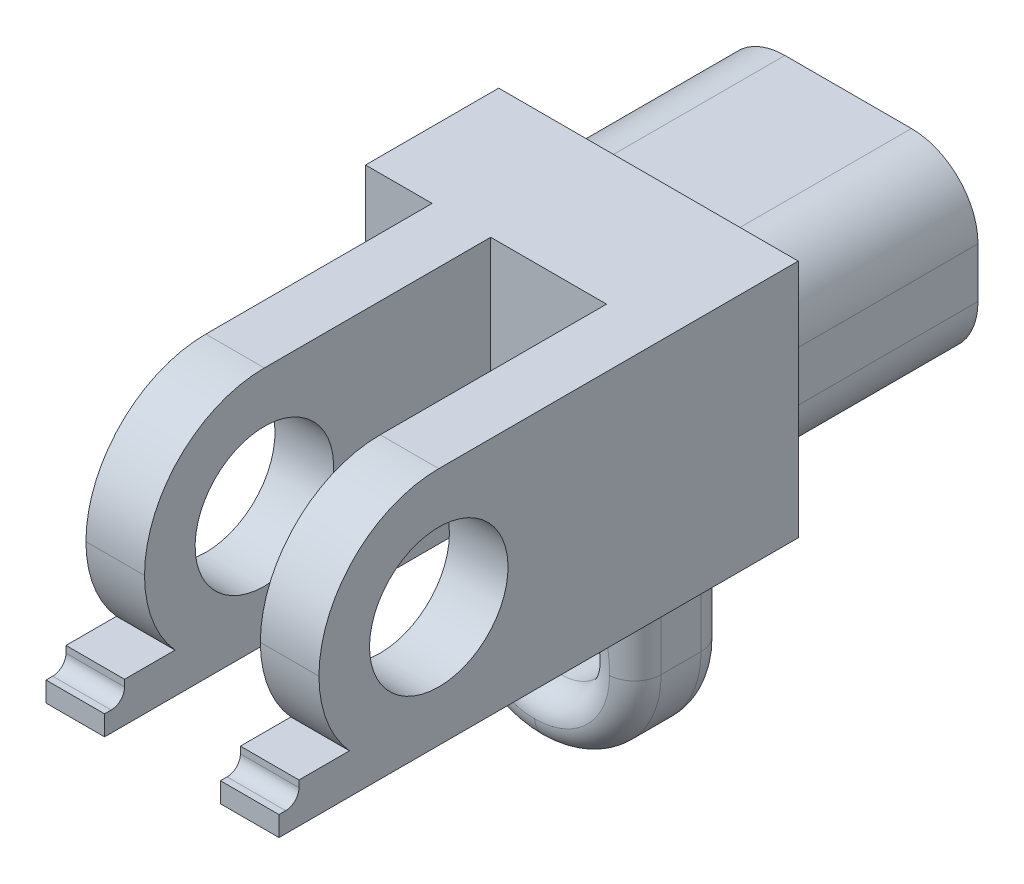
from build123d import *

# Parameters (mm, degrees)
SKETCH2_W           = 24.765
SKETCH2_H           = 17.4625
BOSS_EXTRUDE1_DEPTH = 19.05
SKETCH3_W           = 28.575
SKETCH3_H           = 22.86
BOSS_EXTRUDE2_DEPTH = 45.72
SKETCH4_W           = 6.35
SKETCH4_H           = 33.02
SKETCH4_W_2         = 11.049
CUT_EXTRUDE1_DEPTH  = 54.075706837
SKETCH5_W           = 19.05
SKETCH5_H           = 8.89
BOSS_EXTRUDE3_DEPTH = 19.05
FILLET1_R           = 9.525
SKETCH6_R           = 4.7625
CUT_EXTRUDE2_DEPTH  = 56.202869568
FILLET5_R           = 11.43
SKETCH7_R           = 6.604
CUT_EXTRUDE3_DEPTH  = 60.273091914
FILLET2_R           = 2.54
FILLET3_R           = 6.35
BOSS_EXTRUDE5_DEPTH = 5.588
BOSS_EXTRUDE6_DEPTH = 5.588
SKETCH17_W          = 1.905
SKETCH17_H          = 1.905
CUT_EXTRUDE9_DEPTH  = 63.259151384
FILLET6_R           = 1.27


# Some blends are built 0.0001 mm under size
with BuildPart() as part:
    # Sketch2 → Boss-Extrude1 (new body)
    with BuildSketch(Plane.XY):
        Rectangle(SKETCH2_W, SKETCH2_H)
    extrude(amount=-BOSS_EXTRUDE1_DEPTH)

    # Sketch3 → Boss-Extrude2 (add)
    with BuildSketch(Plane.XY):
        Rectangle(SKETCH3_W, SKETCH3_H)
    extrude(amount=BOSS_EXTRUDE2_DEPTH)

    # Sketch4 → Cut-Extrude1 (cut, through all)
    with BuildSketch(Plane(origin=(0, -11.43, 0), x_dir=(-1, 0, 0), z_dir=(0, -1, 0))):
        with Locations((11.1125, -29.21)):
            Rectangle(SKETCH4_W, SKETCH4_H)
        with Locations((-3.175, -29.21)):
            Rectangle(SKETCH4_W_2, SKETCH4_H)
    extrude(amount=-CUT_EXTRUDE1_DEPTH, mode=Mode.SUBTRACT)

    # Sketch5 → Boss-Extrude3 (add)
    with BuildSketch(Plane.XZ.offset(11.43)):
        with Locations((0, 6.4135)):
            Rectangle(SKETCH5_W, SKETCH5_H)
    extrude(amount=BOSS_EXTRUDE3_DEPTH)

    # Fillet1
    fillet1_edges = [part.edges().sort_by_distance(p)[0] for p in [
        (9.525, -30.48, 6.4135),
        (-9.525, -30.48, 6.4135),
    ]]
    fillet(fillet1_edges, radius=FILLET1_R - 0.0001)  # a hair under: the kernel refuses the full size

    # Sketch6 → Cut-Extrude2 (cut, through all)
    with BuildSketch(Plane(origin=(0, 0, 1.9685), x_dir=(-1, 0, 0), z_dir=(0, 0, -1))):
        with Locations((0, -20.955)):
            Circle(SKETCH6_R)
    extrude(amount=-CUT_EXTRUDE2_DEPTH, mode=Mode.SUBTRACT)

    # Fillet5
    fillet5_edges = [part.edges().sort_by_distance(p)[0] for p in [
        (-5.1435, -11.43, 45.72),
        (-5.1435, 11.43, 45.72),
        (11.4935, 11.43, 45.72),
        (11.4935, -11.43, 45.72),
    ]]
    fillet(fillet5_edges, radius=FILLET5_R - 0.0001)  # a hair under: the kernel refuses the full size

    # Sketch7 → Cut-Extrude3 (cut, through all)
    with BuildSketch(Plane.ZY.offset(7.9375)):
        with Locations(Location((34.29, 0, 0), (0, 0, 270))):
            Circle(SKETCH7_R)
    extrude(amount=-CUT_EXTRUDE3_DEPTH, mode=Mode.SUBTRACT)

    # Fillet2
    # the kernel refuses this fillet: 2.54 mm, written as the material it takes off along each edge
    with BuildSketch(Plane(origin=(-9.525, -11.43, 10.8585), x_dir=(0, 0, -1), z_dir=(0, -1, 0))) as fillet2_piece_1:
        with BuildLine():
            CenterArc((FILLET2_R, FILLET2_R), FILLET2_R, 180, 90)
            Line((0, FILLET2_R), (0, 0))
            Line((0, 0), (FILLET2_R, 0))
        make_face()
    extrude(amount=9.5251, mode=Mode.SUBTRACT)
    with BuildSketch(Plane(origin=(9.525, -11.43, 10.8585), x_dir=(0, 0, -1), z_dir=(0, -1, 0)), Plane(origin=(9.525, -11.43, 1.9685), x_dir=(-1, 0, 0), z_dir=(0, -1, 0)), Plane(origin=(-9.525, -11.43, 1.9685), x_dir=(0, 0, 1), z_dir=(0, -1, 0))) as fillet2_piece_2:
        with BuildLine():
            CenterArc((FILLET2_R, -FILLET2_R), FILLET2_R, 90, 90)
            Line((0, -FILLET2_R), (0, 0))
            Line((0, 0), (FILLET2_R, 0))
        make_face()
    extrude(amount=9.5251, mode=Mode.SUBTRACT)
    with BuildSketch(Plane(origin=(-0.0001, -20.9551, 10.8585), x_dir=(-1, 0, 0), z_dir=(0, 1, 0))) as fillet2_piece_3:
        with BuildLine():
            CenterArc((9.5249 - FILLET2_R, -FILLET2_R), FILLET2_R, 360, 90)
            Line((9.5249, -FILLET2_R), (9.5249, 0))
            Line((9.5249, 0), (9.5249 - FILLET2_R, 0))
        make_face()
    revolve(axis=Axis((-0.0001, -20.9551, 10.8585), (0, 0, 1)), revolution_arc=90, mode=Mode.SUBTRACT)
    with BuildSketch(Plane(origin=(0.0001, -20.9551, 10.8585), x_dir=(1, 0, 0), z_dir=(0, 1, 0))) as fillet2_piece_4:
        with BuildLine():
            CenterArc((9.5249 - FILLET2_R, FILLET2_R), FILLET2_R, 270, 90)
            Line((9.5249, FILLET2_R), (9.5249, 0))
            Line((9.5249, 0), (9.5249 - FILLET2_R, 0))
        make_face()
    revolve(axis=Axis((0.0001, -20.9551, 10.8585), (0, 0, -1)), revolution_arc=90, mode=Mode.SUBTRACT)
    with BuildSketch(Plane(origin=(-0.0001, -20.9551, 1.9685), x_dir=(-1, 0, 0), z_dir=(0, 1, 0))) as fillet2_piece_5:
        with BuildLine():
            CenterArc((9.5249 - FILLET2_R, FILLET2_R), FILLET2_R, 270, 90)
            Line((9.5249, FILLET2_R), (9.5249, 0))
            Line((9.5249, 0), (9.5249 - FILLET2_R, 0))
        make_face()
    revolve(axis=Axis((-0.0001, -20.9551, 1.9685), (0, 0, 1)), revolution_arc=90, mode=Mode.SUBTRACT)
    with BuildSketch(Plane(origin=(0.0001, -20.9551, 1.9685), x_dir=(1, 0, 0), z_dir=(0, 1, 0))) as fillet2_piece_6:
        with BuildLine():
            CenterArc((9.5249 - FILLET2_R, -FILLET2_R), FILLET2_R, 0, 90)
            Line((9.5249, -FILLET2_R), (9.5249, 0))
            Line((9.5249, 0), (9.5249 - FILLET2_R, 0))
        make_face()
    revolve(axis=Axis((0.0001, -20.9551, 1.9685), (0, 0, -1)), revolution_arc=90, mode=Mode.SUBTRACT)
    with BuildSketch(Plane(origin=(0, -20.955, 10.8585), x_dir=(-1, 0, 0), z_dir=(0, -1, 0))) as fillet2_piece_7:
        with BuildLine():
            CenterArc((4.7625 + FILLET2_R, FILLET2_R), FILLET2_R, 180, 90)
            Line((4.7625, FILLET2_R), (4.7625, 0))
            Line((4.7625, 0), (4.7625 + FILLET2_R, 0))
        make_face()
    revolve(axis=Axis((0, -20.955, 10.8585), (0, 0, -1)), mode=Mode.SUBTRACT)
    with BuildSketch(Plane(origin=(0, -20.955, 1.9685), x_dir=(-1, 0, 0), z_dir=(0, -1, 0))) as fillet2_piece_8:
        with BuildLine():
            CenterArc((4.7625 + FILLET2_R, -FILLET2_R), FILLET2_R, 90, 90)
            Line((4.7625, -FILLET2_R), (4.7625, 0))
            Line((4.7625, 0), (4.7625 + FILLET2_R, 0))
        make_face()
    revolve(axis=Axis((0, -20.955, 1.9685), (0, 0, -1)), mode=Mode.SUBTRACT)
    with BuildSketch(Plane(origin=(0.0001, -30.48, 1.9685), x_dir=(0, 1, 0), z_dir=(-1, 0, 0)), Plane(origin=(-0.0001, -30.48, 10.8585), x_dir=(0, 1, 0), z_dir=(1, 0, 0))) as fillet2_piece_9:
        with BuildLine():
            CenterArc((FILLET2_R, -FILLET2_R), FILLET2_R, 90, 90)
            Line((0, -FILLET2_R), (0, 0))
            Line((0, 0), (FILLET2_R, 0))
        make_face()
    extrude(amount=0.0002, mode=Mode.SUBTRACT)

    # Fillet3
    fillet3_edges = [part.edges().sort_by_distance(p)[0] for p in [
        (-12.3825, 8.73125, -9.525),
        (12.3825, 8.73125, -9.525),
        (12.3825, -8.73125, -9.525),
        (-12.3825, -8.73125, -9.525),
    ]]
    fillet(fillet3_edges, radius=FILLET3_R)

    # Sketch14 → Boss-Extrude5 (add)
    with BuildSketch(Plane(origin=(14.2875, 0, 0), x_dir=(0, 0, -1), z_dir=(1, 0, 0))):
        Polygon((-34.29, -11.43), (-49.53, -11.43), (-49.53, -7.62), (-42.809418994, -7.62), align=None)
    extrude(amount=-BOSS_EXTRUDE5_DEPTH)

    # Sketch16 → Boss-Extrude6 (add)
    with BuildSketch(Plane.ZY.offset(7.9375)):
        Polygon((42.809418994, -7.62), (34.29, -11.43), (49.53, -11.43), (49.53, -7.62), align=None)
    extrude(amount=-BOSS_EXTRUDE6_DEPTH)

    # Sketch17 → Cut-Extrude9 (cut, through all)
    with BuildSketch(Plane.ZY.offset(7.9375)):
        with Locations((48.5775, -8.5725)):
            Rectangle(SKETCH17_W, SKETCH17_H)
    extrude(amount=-CUT_EXTRUDE9_DEPTH, mode=Mode.SUBTRACT)

    # Fillet6
    fillet6_edges = [part.edges().sort_by_distance(p)[0] for p in [
        (-5.1435, -9.525, 47.625),
        (11.4935, -9.525, 47.625),
    ]]
    fillet(fillet6_edges, radius=FILLET6_R)


solid = part.part
